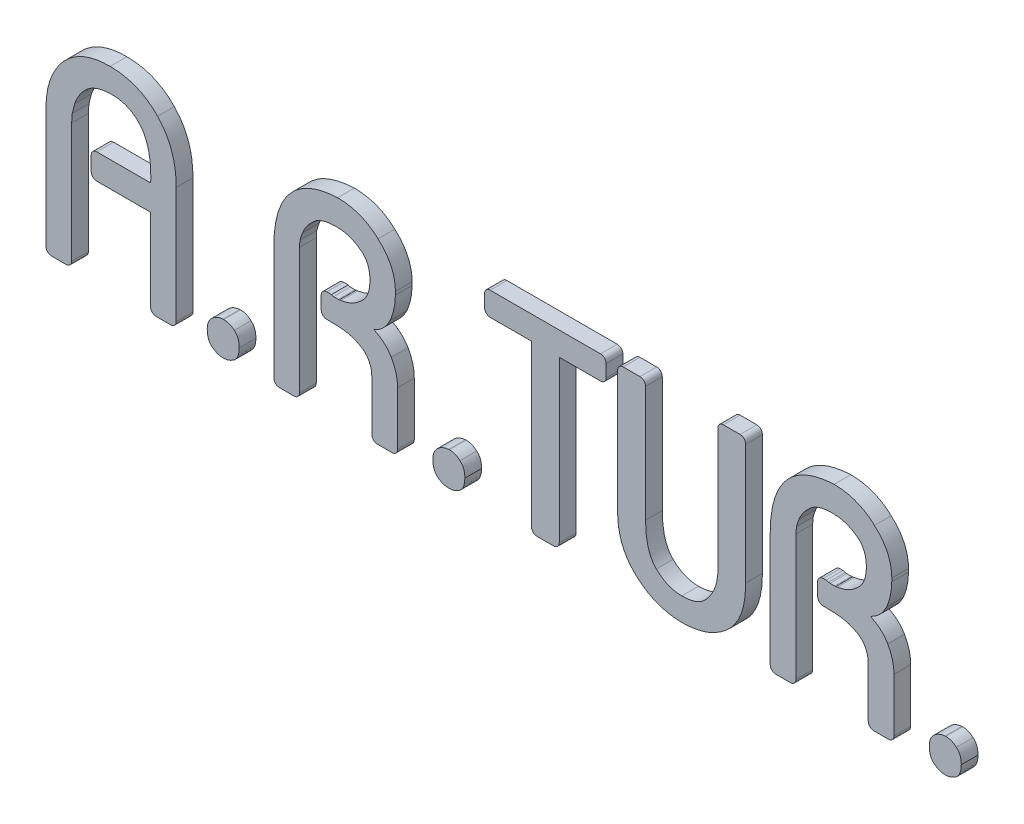
from build123d import *

# Parameters (mm, degrees)
BOSS_EXTRU_1_DEPTH      = 3
BOSS_EXTRU_1_2_DEPTH    = 3
BOSS_EXTRU_1_3_DEPTH    = 3
BOSS_EXTRU_1_4_DEPTH    = 3
BOSS_EXTRU_1_5_DEPTH    = 3
BOSS_EXTRU_1_6_DEPTH    = 3
BOSS_EXTRU_1_7_DEPTH    = 3
BOSS_EXTRU_1_8_DEPTH    = 3
ESQUISSE3_W             = 3
ESQUISSE3_H             = 4.561334753
ENL_V_MAT_EXTRU_1_DEPTH = 2
ESQUISSE4_W             = 3
ESQUISSE4_H             = 4.223978716
ENL_V_MAT_EXTRU_2_DEPTH = 2
ESQUISSE5_W             = 3
ESQUISSE5_H             = 4.223978716
ENL_V_MAT_EXTRU_3_DEPTH = 2
ENL_V_START             = -0.042618
ESQUISSE6_W             = 2
ESQUISSE6_H             = 3
ENL_V_MAT_EXTRU_4_DEPTH = 0.042618
ESQUISSE7_W             = 2
ESQUISSE7_H             = 3
ENL_V_MAT_EXTRU_5_DEPTH = 0.042618
CONG_1_R                = 1
CONG_2_R                = 1
CONG_3_R                = 1
CONG_4_R                = 1
CONG_6_R                = 1
CONG_7_R                = 1


with BuildPart() as part:
    # Esquisse2 → Boss.-Extru.1 (new body)
    with BuildSketch(Plane.XY):
        with BuildLine():
            Line((-83.102372291, -17.6), (-83.102372291, 4.988797988))
            add(Edge.make_bspline(
                [(-83.102372291, 4.988797988), (-83.092949675, 5.40390946), (-83.074474621, 6.217824362), (-82.928161922, 7.413883793), (-82.702489337, 8.561134049), (-82.365965622, 9.657730126), (-81.945713245, 10.711620833), (-81.420249619, 11.717859176), (-80.810673329, 12.687759692), (-80.334299867, 13.288630517), (-80.09428096, 13.591376935)],
                knots=[0, 0, 0, 0, 1.070056633, 2.098075088, 3.102701335, 4.081123745, 5.051437982, 6.024081097, 7.004440979, 8, 8, 8, 8], degree=3))
            add(Edge.make_bspline(
                [(-80.09428096, 13.591376935), (-79.828777775, 13.872098531), (-79.304302249, 14.426636538), (-78.410095479, 15.140317174), (-77.455694847, 15.754476186), (-76.424329439, 16.257125986), (-75.322014921, 16.653193397), (-74.143135808, 16.930597271), (-72.890777242, 17.103746811), (-72.031118657, 17.123487816), (-71.590097523, 17.133615325)],
                knots=[0, 0, 0, 0, 0.974449976, 1.924930451, 2.879798784, 3.834685434, 4.814987156, 5.830638503, 6.88707647, 8, 8, 8, 8], degree=3))
            add(Edge.make_bspline(
                [(-71.590097523, 17.133615325), (-71.170248689, 17.122468537), (-70.343784638, 17.100526307), (-69.133116, 16.937910349), (-67.976654601, 16.663009541), (-66.877454915, 16.27457455), (-65.832745601, 15.782259134), (-64.849097512, 15.180797247), (-63.925708524, 14.467639525), (-63.372967205, 13.914017488), (-63.092942337, 13.63354644)],
                knots=[0, 0, 0, 0, 1.064931283, 2.096295975, 3.09241473, 4.075522731, 5.048572496, 6.016927927, 6.995353749, 8, 8, 8, 8], degree=3))
            add(Edge.make_bspline(
                [(-63.092942337, 13.63354644), (-62.821079076, 13.337189325), (-62.278306348, 12.745514825), (-61.592405699, 11.75340296), (-61.008804489, 10.692623874), (-60.547818029, 9.550639645), (-60.180888697, 8.339606862), (-59.921752265, 7.047812098), (-59.765838178, 5.679098523), (-59.749047734, 4.738544543), (-59.740466718, 4.257859907)],
                knots=[0, 0, 0, 0, 0.943498659, 1.88368718, 2.824197585, 3.781502294, 4.770088047, 5.791872426, 6.871502305, 8, 8, 8, 8], degree=3))
            add(Edge.make_bspline(
                [(-59.740466718, 4.257859907), (-59.740466718, 4.243803406), (-59.740466718, 4.220375903), (-59.740466718, 4.1922629), (-59.740466718, 4.175863648), (-59.740466718, 4.168835397), (-59.740466718, 4.166492647)],
                knots=[0, 0, 0, 0, 1.846153846, 3.076923077, 3.692307692, 4, 4, 4, 4], degree=3))
            add(Edge.make_bspline(
                [(-59.740466718, 4.166492647), (-59.740466718, 4.152436146), (-59.740466718, 4.126665893), (-59.740466718, 4.091524639), (-59.740466718, 4.056383385), (-59.740466718, 4.032955882), (-59.740466718, 4.018899381)],
                knots=[0, 0, 0, 0, 1.142857143, 2.095238095, 2.857142857, 4, 4, 4, 4], degree=3))
            add(Edge.make_bspline(
                [(-59.740466718, 4.018899381), (-59.740466718, 4.002500129), (-59.740466718, 3.969701625), (-59.740466718, 3.92050387), (-59.740466718, 3.871306115), (-59.740466718, 3.838507611), (-59.740466718, 3.822108359)],
                knots=[0, 0, 0, 0, 1, 2, 3, 4, 4, 4, 4], degree=3))
            add(Edge.make_bspline(
                [(-59.740466718, 3.822108359), (-59.740466718, 3.803366357), (-59.740466718, 3.763539603), (-59.740466718, 3.697942595), (-59.740466718, 3.620631837), (-59.740466718, 3.564405831), (-59.740466718, 3.533950077)],
                knots=[0, 0, 0, 0, 0.780487805, 1.658536585, 2.731707317, 4, 4, 4, 4], degree=3))
            add(Edge.make_bspline(
                [(-59.740466718, 3.533950077), (-59.740466718, 3.517550826), (-59.740466718, 3.484752322), (-59.740466718, 3.435554567), (-59.740466718, 3.386356811), (-59.740466718, 3.353558308), (-59.740466718, 3.337159056)],
                knots=[0, 0, 0, 0, 1, 2, 3, 4, 4, 4, 4], degree=3))
            Line((-59.740466718, 3.337159056), (-59.740466718, -17.6))
            Line((-59.740466718, -17.6), (-64.350999226, -17.6))
            Line((-64.350999226, -17.6), (-64.350999226, -1.905916022))
            Line((-64.350999226, -1.905916022), (-76.987794118, -1.905916022))
            Line((-76.987794118, -1.905916022), (-76.987794118, 2.655418731))
            Line((-76.987794118, 2.655418731), (-64.350999226, 2.655418731))
            add(Edge.make_bspline(
                [(-64.350999226, 2.655418731), (-64.350999226, 2.662446981), (-64.350999226, 2.685874484), (-64.350999226, 2.732729489), (-64.350999226, 2.791298246), (-64.350999226, 2.83346775), (-64.350999226, 2.852209752)],
                knots=[0, 0, 0, 0, 0.428571429, 1.428571429, 2.857142857, 4, 4, 4, 4], degree=3))
            add(Edge.make_bspline(
                [(-64.350999226, 2.852209752), (-64.350765827, 2.868603748), (-64.350299028, 2.901391741), (-64.353846716, 2.951325611), (-64.338984044, 3.004598761), (-64.314864967, 3.033400844), (-64.301801471, 3.049000774)],
                knots=[0, 0, 0, 0, 0.937005296, 1.874010592, 2.84851081, 4, 4, 4, 4], degree=3))
            add(Edge.make_bspline(
                [(-64.301801471, 3.049000774), (-64.301801471, 3.053686275), (-64.301801471, 3.067742776), (-64.301801471, 3.098198529), (-64.301801471, 3.140368034), (-64.301801471, 3.173166538), (-64.301801471, 3.189565789)],
                knots=[0, 0, 0, 0, 0.4, 1.2, 2.6, 4, 4, 4, 4], degree=3))
            add(Edge.make_bspline(
                [(-64.301801471, 3.189565789), (-64.301801471, 3.220021543), (-64.301801471, 3.276247549), (-64.301801471, 3.355901058), (-64.301801471, 3.423840815), (-64.301801471, 3.46601032), (-64.301801471, 3.484752322)],
                knots=[0, 0, 0, 0, 1.238095238, 2.285714286, 3.238095238, 4, 4, 4, 4], degree=3))
            add(Edge.make_bspline(
                [(-64.301801471, 3.484752322), (-64.301801471, 3.501151574), (-64.301801471, 3.533950077), (-64.301801471, 3.583147833), (-64.301801471, 3.630002838), (-64.301801471, 3.660458591), (-64.301801471, 3.674515093)],
                knots=[0, 0, 0, 0, 1.037037037, 2.074074074, 3.111111111, 4, 4, 4, 4], degree=3))
            add(Edge.make_bspline(
                [(-64.301801471, 3.674515093), (-64.301801471, 3.679200593), (-64.301801471, 3.695599845), (-64.301801471, 3.728398349), (-64.301801471, 3.772910604), (-64.301801471, 3.805709107), (-64.301801471, 3.822108359)],
                knots=[0, 0, 0, 0, 0.380952381, 1.333333333, 2.666666667, 4, 4, 4, 4], degree=3))
            add(Edge.make_bspline(
                [(-64.301801471, 3.822108359), (-64.307024014, 4.190068887), (-64.317151128, 4.903586858), (-64.399981736, 5.93939485), (-64.546514039, 6.902264108), (-64.749447713, 7.793161411), (-65.007131916, 8.610438836), (-65.32364891, 9.356197382), (-65.701931434, 10.028166041), (-66.00298045, 10.429266398), (-66.150231424, 10.625455108)],
                knots=[0, 0, 0, 0, 1.228968542, 2.38311198, 3.467697717, 4.479462079, 5.432252885, 6.326186899, 7.181294084, 8, 8, 8, 8], degree=3))
            add(Edge.make_bspline(
                [(-66.150231424, 10.625455108), (-66.307762348, 10.805216678), (-66.618705429, 11.160039814), (-67.15504516, 11.619216054), (-67.732525384, 12.017171391), (-68.360132612, 12.338083878), (-69.026513377, 12.594608438), (-69.734047066, 12.775290246), (-70.480426803, 12.892297343), (-70.992246275, 12.903788222), (-71.252741486, 12.90963661)],
                knots=[0, 0, 0, 0, 0.990712156, 1.955521383, 2.920820236, 3.894744745, 4.873267486, 5.877715849, 6.919844033, 8, 8, 8, 8], degree=3))
            add(Edge.make_bspline(
                [(-71.252741486, 12.90963661), (-71.496674892, 12.907264293), (-71.971815911, 12.902643419), (-72.661524962, 12.818429936), (-73.312758383, 12.706317479), (-73.917756246, 12.526362361), (-74.478007995, 12.311577584), (-74.993200034, 12.056291082), (-75.459916821, 11.756370946), (-75.734731296, 11.516764757), (-75.870302245, 11.398562693)],
                knots=[0, 0, 0, 0, 1.176399509, 2.291427287, 3.349265731, 4.361905875, 5.331989761, 6.242172059, 7.132831703, 8, 8, 8, 8], degree=3))
            add(Edge.make_bspline(
                [(-75.870302245, 11.398562693), (-76.114400054, 11.154407205), (-76.591461634, 10.677232897), (-77.166692333, 9.866053774), (-77.622837634, 9.022278473), (-77.846727418, 8.435369278), (-77.957692724, 8.144482585)],
                knots=[0, 0, 0, 0, 1.05958582, 2.070840728, 3.043861015, 4, 4, 4, 4], degree=3))
            add(Edge.make_bspline(
                [(-77.957692724, 8.144482585), (-78.000716745, 7.999476712), (-78.08641238, 7.7106527), (-78.199268787, 7.274715811), (-78.294336409, 6.837063024), (-78.360408318, 6.546671937), (-78.393444272, 6.401476393)],
                knots=[0, 0, 0, 0, 1.00988184, 2.011491803, 3.005745901, 4, 4, 4, 4], degree=3))
            add(Edge.make_bspline(
                [(-78.393444272, 6.401476393), (-78.407352957, 6.260910401), (-78.434000309, 5.991603005), (-78.474522715, 5.605660816), (-78.485531775, 5.241867631), (-78.489737534, 5.007534118), (-78.491839783, 4.890402477)],
                knots=[0, 0, 0, 0, 1.118848889, 2.14357881, 3.07206759, 4, 4, 4, 4], degree=3))
            Line((-78.491839783, 4.890402477), (-78.491839783, -17.6))
            Line((-78.491839783, -17.6), (-83.102372291, -17.6))
        make_face()
    extrude(amount=BOSS_EXTRU_1_DEPTH)

    # Esquisse3 → Enlèv. mat.-Extru.1 (cut)
    with BuildSketch(Plane.ZY.offset(76.987794118)):
        with Locations((1.5, 0.374751354)):
            Rectangle(ESQUISSE3_W, ESQUISSE3_H)
    extrude(amount=-ENL_V_MAT_EXTRU_1_DEPTH, mode=Mode.SUBTRACT)

    # Congé1
    cong_1_edges = [part.edges().sort_by_distance(p)[0] for p in [
        (-64.350999226, -17.6, 1.5),
        (-59.740466718, -17.6, 1.5),
        (-83.102372291, -17.6, 1.5),
        (-74.987794118, 2.655418731, 1.5),
        (-74.987794118, -1.905916022, 1.5),
    ]]
    fillet(cong_1_edges, radius=CONG_1_R)

    # Congé7
    cong_7_edges = [part.edges().sort_by_distance(p)[0] for p in [
        (-78.491839783, -17.6, 1.5),
    ]]
    fillet(cong_7_edges, radius=CONG_7_R)


with BuildPart() as body_2:
    # Esquisse2 → Boss.-Extru.1 2 (new body)
    with BuildSketch(Plane.XY):
        with BuildLine():
            add(Edge.make_bspline(
                [(-54.174092105, -14.929264706), (-54.163600311, -14.72419675), (-54.143227617, -14.326001122), (-53.975244075, -13.758536598), (-53.704755387, -13.246856526), (-53.436487202, -12.976709959), (-53.302589009, -12.841874226)],
                knots=[0, 0, 0, 0, 1.054600379, 2.047795612, 3.025614461, 4, 4, 4, 4], degree=3))
            add(Edge.make_bspline(
                [(-53.302589009, -12.841874226), (-53.154531954, -12.720683836), (-52.869816804, -12.487633541), (-52.380188948, -12.248250259), (-51.878738801, -12.079908599), (-51.530348082, -12.035030045), (-51.355763545, -12.012540635)],
                knots=[0, 0, 0, 0, 1.063594773, 2.045303048, 3.020467982, 4, 4, 4, 4], degree=3))
            add(Edge.make_bspline(
                [(-51.355763545, -12.012540635), (-51.351078044, -12.012540635), (-51.334678793, -12.012540635), (-51.318279541, -12.012540635), (-51.306565789, -12.012540635)],
                knots=[0, 0, 0, 0, 0.571428571, 2, 2, 2, 2], degree=3))
            add(Edge.make_bspline(
                [(-51.306565789, -12.012540635), (-51.304223039, -12.012540635), (-51.297194788, -12.012540635), (-51.278452786, -12.012540635), (-51.247997033, -12.012540635), (-51.22222678, -12.012540635), (-51.208170279, -12.012540635)],
                knots=[0, 0, 0, 0, 0.285714286, 0.857142857, 2.285714286, 4, 4, 4, 4], degree=3))
            add(Edge.make_bspline(
                [(-51.208170279, -12.012540635), (-51.036111397, -12.01951332), (-50.69819895, -12.03320722), (-50.208159882, -12.177048502), (-49.736815974, -12.403487604), (-49.461061808, -12.627113243), (-49.31757082, -12.743478715)],
                knots=[0, 0, 0, 0, 0.993501924, 1.951173132, 2.933875801, 4, 4, 4, 4], degree=3))
            add(Edge.make_bspline(
                [(-49.31757082, -12.743478715), (-49.182505005, -12.870348994), (-48.903547787, -13.132379618), (-48.636768572, -13.679227357), (-48.465569863, -14.318912739), (-48.44821006, -14.782672119), (-48.439039474, -15.027660217)],
                knots=[0, 0, 0, 0, 0.873343845, 1.803754468, 2.839799172, 4, 4, 4, 4], degree=3))
            add(Edge.make_bspline(
                [(-48.439039474, -15.027660217), (-48.448301747, -15.270264703), (-48.465914936, -15.731602711), (-48.638742072, -16.373285449), (-48.908490778, -16.930709362), (-49.182958965, -17.214719537), (-49.31757082, -17.354011223)],
                knots=[0, 0, 0, 0, 1.134974735, 2.158274115, 3.096732702, 4, 4, 4, 4], degree=3))
            add(Edge.make_bspline(
                [(-49.31757082, -17.354011223), (-49.466168604, -17.445308795), (-49.763001621, -17.627681192), (-50.231065983, -17.859822021), (-50.735822033, -18.006250317), (-51.083076031, -18.025892727), (-51.257368034, -18.035751548)],
                knots=[0, 0, 0, 0, 1.003202675, 2.003957737, 2.998156372, 4, 4, 4, 4], degree=3))
            add(Edge.make_bspline(
                [(-51.257368034, -18.035751548), (-51.433861009, -18.027563869), (-51.789000621, -18.0110886), (-52.308423864, -17.87917779), (-52.810743245, -17.672513208), (-53.104711184, -17.460992156), (-53.253391254, -17.354011223)],
                knots=[0, 0, 0, 0, 0.985163287, 1.982348061, 2.979532834, 4, 4, 4, 4], degree=3))
            add(Edge.make_bspline(
                [(-53.253391254, -17.354011223), (-53.400500434, -17.215941043), (-53.696038366, -16.938562191), (-53.985509035, -16.377418442), (-54.14393965, -15.730090063), (-54.163691694, -15.269947585), (-54.174092105, -15.027660217)],
                knots=[0, 0, 0, 0, 0.929924183, 1.868189794, 2.877498366, 4, 4, 4, 4], degree=3))
            Line((-54.174092105, -15.027660217), (-54.174092105, -14.929264706))
        make_face()
    extrude(amount=BOSS_EXTRU_1_2_DEPTH)


with BuildPart() as body_3:
    # Esquisse2 → Boss.-Extru.1 3 (new body)
    with BuildSketch(Plane.XY):
        with BuildLine():
            Line((-42.23309404, -17.6), (-42.23309404, 3.822108359))
            add(Edge.make_bspline(
                [(-42.23309404, 3.822108359), (-42.226151894, 4.326138767), (-42.212628984, 5.307961579), (-42.074694422, 6.735286866), (-41.86277896, 8.075689269), (-41.552880443, 9.326772182), (-41.154773261, 10.490788074), (-40.659925778, 11.567690798), (-40.073870543, 12.560196271), (-39.599976662, 13.15136526), (-39.365567724, 13.443783669)],
                knots=[0, 0, 0, 0, 1.179465841, 2.29753295, 3.353222995, 4.353387927, 5.310675874, 6.228348747, 7.123662693, 8, 8, 8, 8], degree=3))
            add(Edge.make_bspline(
                [(-39.365567724, 13.443783669), (-39.121693683, 13.717775155), (-38.634170173, 14.265505819), (-37.775767399, 14.966634997), (-36.838643825, 15.587417004), (-35.794376991, 16.08844433), (-34.665702894, 16.506161911), (-33.445275857, 16.817750041), (-32.13811315, 17.039653261), (-31.234739754, 17.101697753), (-30.770017028, 17.133615325)],
                knots=[0, 0, 0, 0, 0.912478216, 1.82411617, 2.751644032, 3.706940466, 4.702190389, 5.745444488, 6.840188135, 8, 8, 8, 8], degree=3))
            add(Edge.make_bspline(
                [(-30.770017028, 17.133615325), (-30.427647605, 17.125390524), (-29.749907208, 17.109109047), (-28.751056437, 16.983358939), (-27.78922204, 16.759033008), (-26.856216318, 16.469069766), (-25.962129269, 16.076572128), (-25.099185222, 15.609347435), (-24.284856227, 15.033487106), (-23.784586325, 14.589575164), (-23.530918731, 14.36448452)],
                knots=[0, 0, 0, 0, 1.034309447, 2.047476348, 3.034821847, 4.015318387, 4.994945852, 5.980157755, 6.975815814, 8, 8, 8, 8], degree=3))
            add(Edge.make_bspline(
                [(-23.530918731, 14.36448452), (-23.281632495, 14.138077508), (-22.793375739, 13.694632433), (-22.167524524, 12.945063198), (-21.626131532, 12.16497095), (-21.193998208, 11.33811088), (-20.841451699, 10.486613518), (-20.607535868, 9.599623963), (-20.451323817, 8.688836491), (-20.433451987, 8.070174105), (-20.424431889, 7.757928793)],
                knots=[0, 0, 0, 0, 1.071402239, 2.098468779, 3.102259339, 4.090284332, 5.064376597, 6.03098092, 7.006215681, 8, 8, 8, 8], degree=3))
            add(Edge.make_bspline(
                [(-20.424431889, 7.757928793), (-20.424431889, 7.739186791), (-20.424431889, 7.697017286), (-20.424431889, 7.629077528), (-20.424431889, 7.55176677), (-20.424431889, 7.497883514), (-20.424431889, 7.469770511)],
                knots=[0, 0, 0, 0, 0.780487805, 1.756097561, 2.829268293, 4, 4, 4, 4], degree=3))
            add(Edge.make_bspline(
                [(-20.424431889, 7.469770511), (-20.424431889, 7.451028509), (-20.424431889, 7.408859004), (-20.424431889, 7.340919247), (-20.424431889, 7.261265738), (-20.424431889, 7.205039732), (-20.424431889, 7.174583978)],
                knots=[0, 0, 0, 0, 0.761904762, 1.714285714, 2.761904762, 4, 4, 4, 4], degree=3))
            add(Edge.make_bspline(
                [(-20.424431889, 7.174583978), (-20.436700973, 6.791920273), (-20.46107857, 6.031600981), (-20.652372058, 4.916243241), (-20.938523061, 3.835284456), (-21.20946538, 3.147434884), (-21.34513274, 2.803011997)],
                knots=[0, 0, 0, 0, 1.020809319, 2.028258779, 3.012701566, 4, 4, 4, 4], degree=3))
            add(Edge.make_bspline(
                [(-21.34513274, 2.803011997), (-21.516652382, 2.479454012), (-21.851420387, 1.847941144), (-22.535819013, 1.037430808), (-23.333559031, 0.361175813), (-23.949972713, 0.045838001), (-24.261856811, -0.113712074)],
                knots=[0, 0, 0, 0, 1.041192477, 2.032174995, 3.004348305, 4, 4, 4, 4], degree=3))
            add(Edge.make_bspline(
                [(-24.261856811, -0.113712074), (-23.946926179, -0.268175286), (-23.325929116, -0.572754108), (-22.49438437, -1.196029604), (-21.737486906, -1.932003488), (-21.348398588, -2.52747339), (-21.148341718, -2.833645124)],
                knots=[0, 0, 0, 0, 1.000493697, 1.972826981, 2.957691943, 4, 4, 4, 4], degree=3))
            add(Edge.make_bspline(
                [(-21.148341718, -2.833645124), (-20.982184853, -3.148275586), (-20.645856954, -3.785137636), (-20.30805151, -4.822482287), (-20.066699192, -5.901033655), (-20.042800352, -6.639272898), (-20.030849845, -7.008426084)],
                knots=[0, 0, 0, 0, 0.975776978, 1.975127657, 2.987471768, 4, 4, 4, 4], degree=3))
            Line((-20.030849845, -7.008426084), (-20.030849845, -17.6))
            Line((-20.030849845, -17.6), (-24.648410604, -17.6))
            Line((-24.648410604, -17.6), (-24.648410604, -7.640968653))
            add(Edge.make_bspline(
                [(-24.648410604, -7.640968653), (-24.653718845, -7.443905698), (-24.664070912, -7.059595982), (-24.747042758, -6.50182528), (-24.896368343, -5.982894056), (-25.103126625, -5.503681138), (-25.351457034, -5.055929221), (-25.670276959, -4.661596751), (-26.024951633, -4.294582338), (-26.305797945, -4.099077072), (-26.447642802, -4.000334752)],
                knots=[0, 0, 0, 0, 1.114967711, 2.174396123, 3.181511139, 4.161646928, 5.123680777, 6.067917283, 7.024178051, 8, 8, 8, 8], degree=3))
            add(Edge.make_bspline(
                [(-26.447642802, -4.000334752), (-26.770455743, -3.815727788), (-27.431723584, -3.437568696), (-28.555102069, -3.071622467), (-29.788907994, -2.820197892), (-30.656134062, -2.796682831), (-31.107373065, -2.784447368)],
                knots=[0, 0, 0, 0, 0.912720846, 1.869667741, 2.891535853, 4, 4, 4, 4], degree=3))
            Line((-31.107373065, -2.784447368), (-35.724933824, -2.686051858))
            Line((-35.724933824, -2.686051858), (-35.724933824, 1.537926858))
            Line((-35.724933824, 1.537926858), (-31.887508901, 1.537926858))
            add(Edge.make_bspline(
                [(-31.887508901, 1.537926858), (-31.856076073, 1.510251084), (-31.797752811, 1.458898993), (-31.694318732, 1.413670372), (-31.594823442, 1.404266567), (-31.531385875, 1.399600255), (-31.500955108, 1.397361842)],
                knots=[0, 0, 0, 0, 1.182697103, 2.194481306, 3.133899354, 4, 4, 4, 4], degree=3))
            add(Edge.make_bspline(
                [(-31.500955108, 1.397361842), (-31.468156605, 1.397361842), (-31.402559598, 1.397361842), (-31.304164087, 1.397361842), (-31.205768576, 1.397361842), (-31.140171569, 1.397361842), (-31.107373065, 1.397361842)],
                knots=[0, 0, 0, 0, 1, 2, 3, 4, 4, 4, 4], degree=3))
            add(Edge.make_bspline(
                [(-31.107373065, 1.397361842), (-31.072231811, 1.397361842), (-30.999606553, 1.397361842), (-30.889497291, 1.397361842), (-30.779388029, 1.397361842), (-30.706762771, 1.397361842), (-30.671621517, 1.397361842)],
                knots=[0, 0, 0, 0, 0.967741935, 2, 3.032258065, 4, 4, 4, 4], degree=3))
            add(Edge.make_bspline(
                [(-30.671621517, 1.397361842), (-30.655231836, 1.397536199), (-30.622452475, 1.397884912), (-30.567896139, 1.39499314), (-30.50247276, 1.411069781), (-30.45792751, 1.433714999), (-30.432660991, 1.446559598)],
                knots=[0, 0, 0, 0, 0.79314293, 1.586285859, 2.630916788, 4, 4, 4, 4], degree=3))
            add(Edge.make_bspline(
                [(-30.432660991, 1.446559598), (-30.413918989, 1.446559598), (-30.374092234, 1.446559598), (-30.310837977, 1.446559598), (-30.24758372, 1.446559598), (-30.205414216, 1.446559598), (-30.186672214, 1.446559598)],
                knots=[0, 0, 0, 0, 0.914285714, 1.942857143, 3.085714286, 4, 4, 4, 4], degree=3))
            add(Edge.make_bspline(
                [(-30.186672214, 1.446559598), (-29.865477854, 1.507284595), (-29.223876692, 1.628585695), (-28.300573543, 1.984942769), (-27.415774265, 2.471677056), (-26.899758412, 2.914982585), (-26.637405573, 3.140368034)],
                knots=[0, 0, 0, 0, 0.981007491, 1.959609586, 2.962624468, 4, 4, 4, 4], degree=3))
            add(Edge.make_bspline(
                [(-26.637405573, 3.140368034), (-26.505798033, 3.25937099), (-26.244620274, 3.495534704), (-25.901142154, 3.90041795), (-25.623147617, 4.354074456), (-25.388399688, 4.843455303), (-25.203929323, 5.373341172), (-25.08258895, 5.942627118), (-25.001757042, 6.54678156), (-24.991203802, 6.961114463), (-24.985766641, 7.174583978)],
                knots=[0, 0, 0, 0, 0.944183768, 1.873751319, 2.815211831, 3.76931437, 4.759511945, 5.794580443, 6.863740143, 8, 8, 8, 8], degree=3))
            add(Edge.make_bspline(
                [(-24.985766641, 7.174583978), (-24.988947539, 7.378642469), (-24.995146941, 7.776341764), (-25.067806573, 8.349847072), (-25.177753323, 8.885318071), (-25.340623475, 9.376906597), (-25.542789274, 9.832468189), (-25.79718059, 10.240122088), (-26.094179703, 10.607929201), (-26.329549564, 10.81148325), (-26.447642802, 10.91361339)],
                knots=[0, 0, 0, 0, 1.178060027, 2.295977203, 3.333782085, 4.330908085, 5.281779262, 6.205590154, 7.099682225, 8, 8, 8, 8], degree=3))
            add(Edge.make_bspline(
                [(-26.447642802, 10.91361339), (-26.689540454, 11.095468677), (-27.164689389, 11.452679031), (-27.939101204, 11.876618343), (-28.751289668, 12.196624938), (-29.317607821, 12.31550967), (-29.603327399, 12.375489551)],
                knots=[0, 0, 0, 0, 1.032112255, 2.027332774, 3.004747339, 4, 4, 4, 4], degree=3))
            add(Edge.make_bspline(
                [(-29.603327399, 12.375489551), (-29.6687173, 12.390716634), (-29.798694741, 12.420983957), (-29.994333004, 12.44519963), (-30.188389152, 12.470686212), (-30.317772916, 12.472807863), (-30.383463235, 12.473885062)],
                knots=[0, 0, 0, 0, 1.021753461, 2.030969595, 3.000290038, 4, 4, 4, 4], degree=3))
            add(Edge.make_bspline(
                [(-30.383463235, 12.473885062), (-30.413933589, 12.474106033), (-30.47721817, 12.474564972), (-30.568743129, 12.471082715), (-30.653846297, 12.482138029), (-30.700118073, 12.505571039), (-30.720819272, 12.516054567)],
                knots=[0, 0, 0, 0, 1.060913082, 2.203434863, 3.196247532, 4, 4, 4, 4], degree=3))
            add(Edge.make_bspline(
                [(-30.720819272, 12.516054567), (-30.753617776, 12.516054567), (-30.819214783, 12.516054567), (-30.915267544, 12.516054567), (-31.011320304, 12.516054567), (-31.074574561, 12.516054567), (-31.107373065, 12.516054567)],
                knots=[0, 0, 0, 0, 1.018181818, 2.036363636, 2.981818182, 4, 4, 4, 4], degree=3))
            add(Edge.make_bspline(
                [(-31.107373065, 12.516054567), (-31.320674767, 12.511599071), (-31.733986156, 12.502965726), (-32.333428789, 12.448248591), (-32.893200014, 12.350321099), (-33.412566851, 12.209954744), (-33.892821419, 12.034512224), (-34.336411601, 11.823476142), (-34.737077564, 11.564342803), (-34.975070731, 11.35914934), (-35.092391254, 11.257997678)],
                knots=[0, 0, 0, 0, 1.196716369, 2.318858688, 3.373380872, 4.380903618, 5.333156405, 6.238443452, 7.131627443, 8, 8, 8, 8], degree=3))
            add(Edge.make_bspline(
                [(-35.092391254, 11.257997678), (-35.32045101, 11.047755769), (-35.760485464, 10.642100314), (-36.31118441, 9.966134448), (-36.759413171, 9.271482081), (-36.975079005, 8.780220203), (-37.081386223, 8.538064628)],
                knots=[0, 0, 0, 0, 1.093258391, 2.109409256, 3.068079353, 4, 4, 4, 4], degree=3))
            add(Edge.make_bspline(
                [(-37.081386223, 8.538064628), (-37.127105111, 8.423719405), (-37.216839312, 8.199289681), (-37.329365347, 7.858359519), (-37.426256817, 7.516764316), (-37.491323224, 7.28936542), (-37.524166022, 7.174583978)],
                knots=[0, 0, 0, 0, 1.029919799, 2.021462798, 3.001317259, 4, 4, 4, 4], degree=3))
            add(Edge.make_bspline(
                [(-37.524166022, 7.174583978), (-37.539102904, 7.066924246), (-37.568265652, 6.85672953), (-37.595593904, 6.554158255), (-37.609527115, 6.272746861), (-37.613567304, 6.094587587), (-37.615533282, 6.00789435)],
                knots=[0, 0, 0, 0, 1.113557543, 2.174108249, 3.111511493, 4, 4, 4, 4], degree=3))
            Line((-37.615533282, 6.00789435), (-37.615533282, -17.6))
            Line((-37.615533282, -17.6), (-42.23309404, -17.6))
        make_face()
    extrude(amount=BOSS_EXTRU_1_3_DEPTH)

    # Esquisse4 → Enlèv. mat.-Extru.2 (cut)
    with BuildSketch(Plane.ZY.offset(35.724933824)):
        with Locations((1.5, -0.5740625)):
            Rectangle(ESQUISSE4_W, ESQUISSE4_H)
    extrude(amount=-ENL_V_MAT_EXTRU_2_DEPTH, mode=Mode.SUBTRACT)

    # Esquisse7 → Enlèv. mat.-Extru.5 (cut)
    with BuildSketch(Plane(origin=(0, -2.686051858, 0), x_dir=(1, 0, 0), z_dir=(0, 1, 0)).offset(ENL_V_START)):
        with Locations((-34.724933824, -1.5)):
            Rectangle(ESQUISSE7_W, ESQUISSE7_H)
    extrude(amount=ENL_V_MAT_EXTRU_5_DEPTH, mode=Mode.SUBTRACT)

    # Congé2
    cong_2_edges = [body_3.edges().sort_by_distance(p)[0] for p in [
        (-33.724933824, -2.728669858, 1.5),
        (-37.615533282, -17.6, 1.5),
        (-24.648410604, -17.6, 1.5),
        (-20.030849845, -17.6, 1.5),
        (-42.23309404, -17.6, 1.5),
        (-33.724933824, 1.537926858, 1.5),
    ]]
    fillet(cong_2_edges, radius=CONG_2_R)


with BuildPart() as body_4:
    # Esquisse2 → Boss.-Extru.1 4 (new body)
    with BuildSketch(Plane.XY):
        with BuildLine():
            add(Edge.make_bspline(
                [(-13.691367647, -14.929264706), (-13.680875853, -14.72419675), (-13.660503159, -14.326001122), (-13.492519616, -13.758536598), (-13.222030928, -13.246856526), (-12.953762744, -12.976709959), (-12.819864551, -12.841874226)],
                knots=[0, 0, 0, 0, 1.054600379, 2.047795612, 3.025614461, 4, 4, 4, 4], degree=3))
            add(Edge.make_bspline(
                [(-12.819864551, -12.841874226), (-12.671807496, -12.720683836), (-12.387092345, -12.487633541), (-11.89746449, -12.248250259), (-11.396014342, -12.079908599), (-11.047623624, -12.035030045), (-10.873039087, -12.012540635)],
                knots=[0, 0, 0, 0, 1.063594773, 2.045303048, 3.020467982, 4, 4, 4, 4], degree=3))
            add(Edge.make_bspline(
                [(-10.873039087, -12.012540635), (-10.868353586, -12.012540635), (-10.851954334, -12.012540635), (-10.835555083, -12.012540635), (-10.823841331, -12.012540635)],
                knots=[0, 0, 0, 0, 0.571428571, 2, 2, 2, 2], degree=3))
            add(Edge.make_bspline(
                [(-10.823841331, -12.012540635), (-10.821498581, -12.012540635), (-10.81447033, -12.012540635), (-10.795728328, -12.012540635), (-10.765272575, -12.012540635), (-10.739502322, -12.012540635), (-10.72544582, -12.012540635)],
                knots=[0, 0, 0, 0, 0.285714286, 0.857142857, 2.285714286, 4, 4, 4, 4], degree=3))
            add(Edge.make_bspline(
                [(-10.72544582, -12.012540635), (-10.553386939, -12.01951332), (-10.215474492, -12.03320722), (-9.725435424, -12.177048502), (-9.254091516, -12.403487604), (-8.97833735, -12.627113243), (-8.834846362, -12.743478715)],
                knots=[0, 0, 0, 0, 0.993501924, 1.951173132, 2.933875801, 4, 4, 4, 4], degree=3))
            add(Edge.make_bspline(
                [(-8.834846362, -12.743478715), (-8.699780546, -12.870348994), (-8.420823329, -13.132379618), (-8.154044114, -13.679227357), (-7.982845405, -14.318912739), (-7.965485601, -14.782672119), (-7.956315015, -15.027660217)],
                knots=[0, 0, 0, 0, 0.873343845, 1.803754468, 2.839799172, 4, 4, 4, 4], degree=3))
            add(Edge.make_bspline(
                [(-7.956315015, -15.027660217), (-7.965577289, -15.270264703), (-7.983190478, -15.731602711), (-8.156017613, -16.373285449), (-8.42576632, -16.930709362), (-8.700234507, -17.214719537), (-8.834846362, -17.354011223)],
                knots=[0, 0, 0, 0, 1.134974735, 2.158274115, 3.096732702, 4, 4, 4, 4], degree=3))
            add(Edge.make_bspline(
                [(-8.834846362, -17.354011223), (-8.983444145, -17.445308795), (-9.280277163, -17.627681192), (-9.748341525, -17.859822021), (-10.253097575, -18.006250317), (-10.600351572, -18.025892727), (-10.774643576, -18.035751548)],
                knots=[0, 0, 0, 0, 1.003202675, 2.003957737, 2.998156372, 4, 4, 4, 4], degree=3))
            add(Edge.make_bspline(
                [(-10.774643576, -18.035751548), (-10.951136551, -18.027563869), (-11.306276163, -18.0110886), (-11.825699406, -17.87917779), (-12.328018786, -17.672513208), (-12.621986726, -17.460992156), (-12.770666796, -17.354011223)],
                knots=[0, 0, 0, 0, 0.985163287, 1.982348061, 2.979532834, 4, 4, 4, 4], degree=3))
            add(Edge.make_bspline(
                [(-12.770666796, -17.354011223), (-12.917775976, -17.215941043), (-13.213313908, -16.938562191), (-13.502784577, -16.377418442), (-13.661215192, -15.730090063), (-13.680967236, -15.269947585), (-13.691367647, -15.027660217)],
                knots=[0, 0, 0, 0, 0.929924183, 1.868189794, 2.877498366, 4, 4, 4, 4], degree=3))
            Line((-13.691367647, -15.027660217), (-13.691367647, -14.929264706))
        make_face()
    extrude(amount=BOSS_EXTRU_1_4_DEPTH)


with BuildPart() as body_5:
    # Esquisse2 → Boss.-Extru.1 5 (new body)
    with BuildSketch(Plane.XY):
        Polygon((-4.421104876, 12.227896285), (-4.421104876, 16.451875), (17.387557276, 16.451875), (17.387557276, 12.227896285), (8.98176935, 12.227896285), (8.98176935, -17.6), (3.977654799, -17.6), (3.977654799, 12.227896285), align=None)
    extrude(amount=BOSS_EXTRU_1_5_DEPTH)

    # Congé6
    cong_6_edges = [body_5.edges().sort_by_distance(p)[0] for p in [
        (3.977654799, -17.6, 1.5),
        (8.98176935, -17.6, 1.5),
        (17.387557276, 12.227896285, 1.5),
        (17.387557276, 16.451875, 1.5),
        (-4.421104876, 16.451875, 1.5),
        (-4.421104876, 12.227896285, 1.5),
    ]]
    fillet(cong_6_edges, radius=CONG_6_R)


with BuildPart() as body_6:
    # Esquisse2 → Boss.-Extru.1 6 (new body)
    with BuildSketch(Plane.XY):
        with BuildLine():
            Line((19.453863003, 16.451875), (24.457977554, 16.451875))
            Line((24.457977554, 16.451875), (24.457977554, -5.356787152))
            add(Edge.make_bspline(
                [(24.457977554, -5.356787152), (24.462391164, -5.73883946), (24.470853409, -6.471350986), (24.561809286, -7.523752991), (24.715938587, -8.481853063), (24.921448992, -9.351983058), (25.197521685, -10.130804258), (25.526522716, -10.826572625), (25.919970932, -11.442879434), (26.240293704, -11.791801483), (26.397774768, -11.963342879)],
                knots=[0, 0, 0, 0, 1.298861916, 2.490316912, 3.587787158, 4.596338159, 5.526051681, 6.391865977, 7.209389158, 8, 8, 8, 8], degree=3))
            add(Edge.make_bspline(
                [(26.397774768, -11.963342879), (26.561689417, -12.11149355), (26.883504885, -12.402359424), (27.403829527, -12.785126801), (27.940565693, -13.115492658), (28.503421382, -13.386440648), (29.087942919, -13.596436292), (29.694410946, -13.752664442), (30.3236032, -13.846731038), (30.75028558, -13.856186973), (30.966137771, -13.860970588)],
                knots=[0, 0, 0, 0, 1.044444942, 2.050570462, 3.050146134, 4.021502903, 4.9994102, 5.983013425, 6.979636861, 8, 8, 8, 8], degree=3))
            add(Edge.make_bspline(
                [(30.966137771, -13.860970588), (31.217112202, -13.856473991), (31.704450765, -13.847742562), (32.413099843, -13.754218182), (33.072622406, -13.601739682), (33.685807145, -13.388773756), (34.252806548, -13.11842055), (34.764231921, -12.764940258), (35.232859534, -12.353763877), (35.494449182, -12.02840364), (35.625868034, -11.864947368)],
                knots=[0, 0, 0, 0, 1.142842055, 2.219154366, 3.249557427, 4.221708043, 5.171632766, 6.101191801, 7.046066255, 8, 8, 8, 8], degree=3))
            add(Edge.make_bspline(
                [(35.625868034, -11.864947368), (35.869213208, -11.539411686), (36.348950102, -10.897642322), (36.865903634, -9.816578095), (37.23216276, -8.681102145), (37.327673542, -7.891892916), (37.375902477, -7.493375387)],
                knots=[0, 0, 0, 0, 1.018437844, 2.007774393, 2.994009704, 4, 4, 4, 4], degree=3))
            add(Edge.make_bspline(
                [(37.375902477, -7.493375387), (37.376080252, -7.476988623), (37.376410407, -7.446556061), (37.373830757, -7.394320011), (37.390811309, -7.329401457), (37.412443737, -7.282093406), (37.425100232, -7.254414861)],
                knots=[0, 0, 0, 0, 0.795013122, 1.476452941, 2.523547059, 4, 4, 4, 4], degree=3))
            add(Edge.make_bspline(
                [(37.425100232, -7.254414861), (37.425100232, -7.238015609), (37.425100232, -7.205217105), (37.425100232, -7.15601935), (37.425100232, -7.106821594), (37.425100232, -7.074023091), (37.425100232, -7.057623839)],
                knots=[0, 0, 0, 0, 1, 2, 3, 4, 4, 4, 4], degree=3))
            add(Edge.make_bspline(
                [(37.425100232, -7.057623839), (37.425100232, -7.022482585), (37.425100232, -6.949857327), (37.425100232, -6.839748065), (37.425100232, -6.729638803), (37.425100232, -6.657013545), (37.425100232, -6.621872291)],
                knots=[0, 0, 0, 0, 0.967741935, 2, 3.032258065, 4, 4, 4, 4], degree=3))
            Line((37.425100232, -6.621872291), (37.425100232, 16.451875))
            Line((37.425100232, 16.451875), (42.429214783, 16.451875))
            Line((42.429214783, 16.451875), (42.429214783, -6.136922988))
            add(Edge.make_bspline(
                [(42.429214783, -6.136922988), (42.418498696, -6.636376494), (42.397761259, -7.602903297), (42.236809604, -8.998274398), (41.966526257, -10.287530414), (41.577435842, -11.466266714), (41.093435168, -12.547179619), (40.495469577, -13.523935431), (39.804534753, -14.415535612), (39.253140413, -14.917875563), (38.978343653, -15.168225232)],
                knots=[0, 0, 0, 0, 1.200176211, 2.32254346, 3.370587637, 4.360591543, 5.300507084, 6.210168053, 7.108006767, 8, 8, 8, 8], degree=3))
            add(Edge.make_bspline(
                [(38.978343653, -15.168225232), (38.69218851, -15.401376376), (38.127217132, -15.861699126), (37.210153672, -16.444402513), (36.261672484, -16.943768537), (35.265833782, -17.325592536), (34.23825147, -17.624238092), (33.177368153, -17.831890132), (32.082248336, -17.963285643), (31.341354541, -17.978731449), (30.966137771, -17.986553793)],
                knots=[0, 0, 0, 0, 1.019550359, 2.012952711, 2.997768699, 3.977910358, 4.955545613, 5.952551116, 6.963094086, 8, 8, 8, 8], degree=3))
            add(Edge.make_bspline(
                [(30.966137771, -17.986553793), (30.590830357, -17.976924435), (29.849280046, -17.957898291), (28.753667617, -17.811561967), (27.689024623, -17.583221839), (26.65823644, -17.250402264), (25.662295955, -16.820196511), (24.702527746, -16.286822528), (23.769335763, -15.66384846), (23.190828408, -15.176299657), (22.897705882, -14.929264706)],
                knots=[0, 0, 0, 0, 1.020052211, 2.015467871, 2.999921486, 3.976825735, 4.955327438, 5.9445291, 6.958518302, 8, 8, 8, 8], degree=3))
            add(Edge.make_bspline(
                [(22.897705882, -14.929264706), (22.619663564, -14.66586582), (22.068070173, -14.143322757), (21.357664394, -13.260030541), (20.762976299, -12.307416657), (20.272755888, -11.293598803), (19.9125889, -10.206902625), (19.641913251, -9.067107018), (19.488342482, -7.863000687), (19.465524534, -7.04164249), (19.453863003, -6.621872291)],
                knots=[0, 0, 0, 0, 0.989609325, 1.963233392, 2.921390967, 3.888793609, 4.86781259, 5.875923978, 6.914451918, 8, 8, 8, 8], degree=3))
            Line((19.453863003, -6.621872291), (19.453863003, 16.451875))
        make_face()
    extrude(amount=BOSS_EXTRU_1_6_DEPTH)

    # Congé3
    cong_3_edges = [body_6.edges().sort_by_distance(p)[0] for p in [
        (42.429214783, 16.451875, 1.5),
        (37.425100232, 16.451875, 1.5),
        (24.457977554, 16.451875, 1.5),
        (19.453863003, 16.451875, 1.5),
    ]]
    fillet(cong_3_edges, radius=CONG_3_R)


with BuildPart() as body_7:
    # Esquisse2 → Boss.-Extru.1 7 (new body)
    with BuildSketch(Plane.XY):
        with BuildLine():
            Line((46.828899768, -17.6), (46.828899768, 3.822108359))
            add(Edge.make_bspline(
                [(46.828899768, 3.822108359), (46.835841914, 4.326138767), (46.849364824, 5.307961579), (46.987299386, 6.735286866), (47.199214848, 8.075689269), (47.509113365, 9.326772182), (47.907220548, 10.490788074), (48.40206803, 11.567690798), (48.988123265, 12.560196271), (49.462017146, 13.15136526), (49.696426084, 13.443783669)],
                knots=[0, 0, 0, 0, 1.179465841, 2.29753295, 3.353222995, 4.353387927, 5.310675874, 6.228348747, 7.123662693, 8, 8, 8, 8], degree=3))
            add(Edge.make_bspline(
                [(49.696426084, 13.443783669), (49.940300125, 13.717775155), (50.427823635, 14.265505819), (51.286226409, 14.966634997), (52.223349983, 15.587417004), (53.267616817, 16.08844433), (54.396290914, 16.506161911), (55.616717951, 16.817750041), (56.923880658, 17.039653261), (57.827254054, 17.101697753), (58.29197678, 17.133615325)],
                knots=[0, 0, 0, 0, 0.912478216, 1.82411617, 2.751644032, 3.706940466, 4.702190389, 5.745444488, 6.840188135, 8, 8, 8, 8], degree=3))
            add(Edge.make_bspline(
                [(58.29197678, 17.133615325), (58.634346203, 17.125390524), (59.3120866, 17.109109047), (60.310937371, 16.983358939), (61.272771768, 16.759033008), (62.20577749, 16.469069766), (63.099864539, 16.076572128), (63.962808586, 15.609347435), (64.777137581, 15.033487106), (65.277407483, 14.589575164), (65.531075077, 14.36448452)],
                knots=[0, 0, 0, 0, 1.034309447, 2.047476348, 3.034821847, 4.015318387, 4.994945852, 5.980157755, 6.975815814, 8, 8, 8, 8], degree=3))
            add(Edge.make_bspline(
                [(65.531075077, 14.36448452), (65.780361313, 14.138077508), (66.268618069, 13.694632433), (66.894469284, 12.945063198), (67.435862277, 12.16497095), (67.8679956, 11.33811088), (68.220542109, 10.486613518), (68.454457941, 9.599623963), (68.610669991, 8.688836491), (68.628541822, 8.070174105), (68.63756192, 7.757928793)],
                knots=[0, 0, 0, 0, 1.071402239, 2.098468779, 3.102259339, 4.090284332, 5.064376597, 6.03098092, 7.006215681, 8, 8, 8, 8], degree=3))
            add(Edge.make_bspline(
                [(68.63756192, 7.757928793), (68.63756192, 7.739186791), (68.63756192, 7.697017286), (68.63756192, 7.629077528), (68.63756192, 7.55176677), (68.63756192, 7.497883514), (68.63756192, 7.469770511)],
                knots=[0, 0, 0, 0, 0.780487805, 1.756097561, 2.829268293, 4, 4, 4, 4], degree=3))
            add(Edge.make_bspline(
                [(68.63756192, 7.469770511), (68.63756192, 7.451028509), (68.63756192, 7.408859004), (68.63756192, 7.340919247), (68.63756192, 7.261265738), (68.63756192, 7.205039732), (68.63756192, 7.174583978)],
                knots=[0, 0, 0, 0, 0.761904762, 1.714285714, 2.761904762, 4, 4, 4, 4], degree=3))
            add(Edge.make_bspline(
                [(68.63756192, 7.174583978), (68.625292835, 6.791920273), (68.600915238, 6.031600981), (68.40962175, 4.916243241), (68.123470747, 3.835284456), (67.852528428, 3.147434884), (67.716861068, 2.803011997)],
                knots=[0, 0, 0, 0, 1.020809319, 2.028258779, 3.012701566, 4, 4, 4, 4], degree=3))
            add(Edge.make_bspline(
                [(67.716861068, 2.803011997), (67.545341426, 2.479454012), (67.210573421, 1.847941144), (66.526174795, 1.037430808), (65.728434777, 0.361175813), (65.112021095, 0.045838001), (64.800136997, -0.113712074)],
                knots=[0, 0, 0, 0, 1.041192477, 2.032174995, 3.004348305, 4, 4, 4, 4], degree=3))
            add(Edge.make_bspline(
                [(64.800136997, -0.113712074), (65.115067629, -0.268175286), (65.736064692, -0.572754108), (66.567609438, -1.196029604), (67.324506902, -1.932003488), (67.71359522, -2.52747339), (67.91365209, -2.833645124)],
                knots=[0, 0, 0, 0, 1.000493697, 1.972826981, 2.957691943, 4, 4, 4, 4], degree=3))
            add(Edge.make_bspline(
                [(67.91365209, -2.833645124), (68.079808956, -3.148275586), (68.416136854, -3.785137636), (68.753942298, -4.822482287), (68.995294616, -5.901033655), (69.019193456, -6.639272898), (69.031143963, -7.008426084)],
                knots=[0, 0, 0, 0, 0.975776978, 1.975127657, 2.987471768, 4, 4, 4, 4], degree=3))
            Line((69.031143963, -7.008426084), (69.031143963, -17.6))
            Line((69.031143963, -17.6), (64.413583204, -17.6))
            Line((64.413583204, -17.6), (64.413583204, -7.640968653))
            add(Edge.make_bspline(
                [(64.413583204, -7.640968653), (64.408274963, -7.443905698), (64.397922896, -7.059595982), (64.31495105, -6.50182528), (64.165625465, -5.982894056), (63.958867183, -5.503681138), (63.710536774, -5.055929221), (63.391716849, -4.661596751), (63.037042175, -4.294582338), (62.756195863, -4.099077072), (62.614351006, -4.000334752)],
                knots=[0, 0, 0, 0, 1.114967711, 2.174396123, 3.181511139, 4.161646928, 5.123680777, 6.067917283, 7.024178051, 8, 8, 8, 8], degree=3))
            add(Edge.make_bspline(
                [(62.614351006, -4.000334752), (62.291538065, -3.815727788), (61.630270224, -3.437568696), (60.506891739, -3.071622467), (59.273085814, -2.820197892), (58.405859746, -2.796682831), (57.954620743, -2.784447368)],
                knots=[0, 0, 0, 0, 0.912720846, 1.869667741, 2.891535853, 4, 4, 4, 4], degree=3))
            Line((57.954620743, -2.784447368), (53.337059985, -2.686051858))
            Line((53.337059985, -2.686051858), (53.337059985, 1.537926858))
            Line((53.337059985, 1.537926858), (57.174484907, 1.537926858))
            add(Edge.make_bspline(
                [(57.174484907, 1.537926858), (57.205917735, 1.510251084), (57.264240997, 1.458898993), (57.367675076, 1.413670372), (57.467170366, 1.404266567), (57.530607933, 1.399600255), (57.5610387, 1.397361842)],
                knots=[0, 0, 0, 0, 1.182697103, 2.194481306, 3.133899354, 4, 4, 4, 4], degree=3))
            add(Edge.make_bspline(
                [(57.5610387, 1.397361842), (57.593837203, 1.397361842), (57.659434211, 1.397361842), (57.757829721, 1.397361842), (57.856225232, 1.397361842), (57.921822239, 1.397361842), (57.954620743, 1.397361842)],
                knots=[0, 0, 0, 0, 1, 2, 3, 4, 4, 4, 4], degree=3))
            add(Edge.make_bspline(
                [(57.954620743, 1.397361842), (57.989761997, 1.397361842), (58.062387255, 1.397361842), (58.172496517, 1.397361842), (58.282605779, 1.397361842), (58.355231037, 1.397361842), (58.390372291, 1.397361842)],
                knots=[0, 0, 0, 0, 0.967741935, 2, 3.032258065, 4, 4, 4, 4], degree=3))
            add(Edge.make_bspline(
                [(58.390372291, 1.397361842), (58.406761972, 1.397536199), (58.439541333, 1.397884912), (58.494097669, 1.39499314), (58.559521048, 1.411069781), (58.604066298, 1.433714999), (58.629332817, 1.446559598)],
                knots=[0, 0, 0, 0, 0.79314293, 1.586285859, 2.630916788, 4, 4, 4, 4], degree=3))
            add(Edge.make_bspline(
                [(58.629332817, 1.446559598), (58.648074819, 1.446559598), (58.687901574, 1.446559598), (58.751155831, 1.446559598), (58.814410088, 1.446559598), (58.856579592, 1.446559598), (58.875321594, 1.446559598)],
                knots=[0, 0, 0, 0, 0.914285714, 1.942857143, 3.085714286, 4, 4, 4, 4], degree=3))
            add(Edge.make_bspline(
                [(58.875321594, 1.446559598), (59.196515954, 1.507284595), (59.838117116, 1.628585695), (60.761420265, 1.984942769), (61.646219543, 2.471677056), (62.162235396, 2.914982585), (62.424588235, 3.140368034)],
                knots=[0, 0, 0, 0, 0.981007491, 1.959609586, 2.962624468, 4, 4, 4, 4], degree=3))
            add(Edge.make_bspline(
                [(62.424588235, 3.140368034), (62.556195775, 3.25937099), (62.817373534, 3.495534704), (63.160851654, 3.90041795), (63.438846191, 4.354074456), (63.67359412, 4.843455303), (63.858064485, 5.373341172), (63.979404858, 5.942627118), (64.060236766, 6.54678156), (64.070790006, 6.961114463), (64.076227167, 7.174583978)],
                knots=[0, 0, 0, 0, 0.944183768, 1.873751319, 2.815211831, 3.76931437, 4.759511945, 5.794580443, 6.863740143, 8, 8, 8, 8], degree=3))
            add(Edge.make_bspline(
                [(64.076227167, 7.174583978), (64.073046269, 7.378642469), (64.066846867, 7.776341764), (63.994187235, 8.349847072), (63.884240485, 8.885318071), (63.721370333, 9.376906597), (63.519204534, 9.832468189), (63.264813218, 10.240122088), (62.967814105, 10.607929201), (62.732444244, 10.81148325), (62.614351006, 10.91361339)],
                knots=[0, 0, 0, 0, 1.178060027, 2.295977203, 3.333782085, 4.330908085, 5.281779262, 6.205590154, 7.099682225, 8, 8, 8, 8], degree=3))
            add(Edge.make_bspline(
                [(62.614351006, 10.91361339), (62.372453354, 11.095468677), (61.897304419, 11.452679031), (61.122892604, 11.876618343), (60.31070414, 12.196624938), (59.744385987, 12.31550967), (59.458666409, 12.375489551)],
                knots=[0, 0, 0, 0, 1.032112255, 2.027332774, 3.004747339, 4, 4, 4, 4], degree=3))
            add(Edge.make_bspline(
                [(59.458666409, 12.375489551), (59.393276508, 12.390716634), (59.263299067, 12.420983957), (59.067660805, 12.44519963), (58.873604656, 12.470686212), (58.744220892, 12.472807863), (58.678530573, 12.473885062)],
                knots=[0, 0, 0, 0, 1.021753461, 2.030969595, 3.000290038, 4, 4, 4, 4], degree=3))
            add(Edge.make_bspline(
                [(58.678530573, 12.473885062), (58.648060219, 12.474106033), (58.584775638, 12.474564972), (58.493250679, 12.471082715), (58.408147511, 12.482138029), (58.361875736, 12.505571039), (58.341174536, 12.516054567)],
                knots=[0, 0, 0, 0, 1.060913082, 2.203434863, 3.196247532, 4, 4, 4, 4], degree=3))
            add(Edge.make_bspline(
                [(58.341174536, 12.516054567), (58.308376032, 12.516054567), (58.242779025, 12.516054567), (58.146726264, 12.516054567), (58.050673504, 12.516054567), (57.987419247, 12.516054567), (57.954620743, 12.516054567)],
                knots=[0, 0, 0, 0, 1.018181818, 2.036363636, 2.981818182, 4, 4, 4, 4], degree=3))
            add(Edge.make_bspline(
                [(57.954620743, 12.516054567), (57.741319041, 12.511599071), (57.328007652, 12.502965726), (56.728565019, 12.448248591), (56.168793794, 12.350321099), (55.649426957, 12.209954744), (55.169172389, 12.034512224), (54.725582207, 11.823476142), (54.324916244, 11.564342803), (54.086923077, 11.35914934), (53.969602554, 11.257997678)],
                knots=[0, 0, 0, 0, 1.196716369, 2.318858688, 3.373380872, 4.380903618, 5.333156405, 6.238443452, 7.131627443, 8, 8, 8, 8], degree=3))
            add(Edge.make_bspline(
                [(53.969602554, 11.257997678), (53.741542798, 11.047755769), (53.301508344, 10.642100314), (52.750809398, 9.966134448), (52.302580637, 9.271482081), (52.086914804, 8.780220203), (51.980607585, 8.538064628)],
                knots=[0, 0, 0, 0, 1.093258391, 2.109409256, 3.068079353, 4, 4, 4, 4], degree=3))
            add(Edge.make_bspline(
                [(51.980607585, 8.538064628), (51.934888697, 8.423719405), (51.845154496, 8.199289681), (51.732628461, 7.858359519), (51.635736991, 7.516764316), (51.570670584, 7.28936542), (51.537827786, 7.174583978)],
                knots=[0, 0, 0, 0, 1.029919799, 2.021462798, 3.001317259, 4, 4, 4, 4], degree=3))
            add(Edge.make_bspline(
                [(51.537827786, 7.174583978), (51.522890904, 7.066924246), (51.493728156, 6.85672953), (51.466399904, 6.554158255), (51.452466693, 6.272746861), (51.448426504, 6.094587587), (51.446460526, 6.00789435)],
                knots=[0, 0, 0, 0, 1.113557543, 2.174108249, 3.111511493, 4, 4, 4, 4], degree=3))
            Line((51.446460526, 6.00789435), (51.446460526, -17.6))
            Line((51.446460526, -17.6), (46.828899768, -17.6))
        make_face()
    extrude(amount=BOSS_EXTRU_1_7_DEPTH)

    # Esquisse5 → Enlèv. mat.-Extru.3 (cut)
    with BuildSketch(Plane.ZY.offset(-53.337059985)):
        with Locations((1.5, -0.5740625)):
            Rectangle(ESQUISSE5_W, ESQUISSE5_H)
    extrude(amount=-ENL_V_MAT_EXTRU_3_DEPTH, mode=Mode.SUBTRACT)

    # Esquisse6 → Enlèv. mat.-Extru.4 (cut)
    with BuildSketch(Plane(origin=(0, -2.686051858, 0), x_dir=(1, 0, 0), z_dir=(0, 1, 0)).offset(ENL_V_START)):
        with Locations((54.337059985, -1.5)):
            Rectangle(ESQUISSE6_W, ESQUISSE6_H)
    extrude(amount=ENL_V_MAT_EXTRU_4_DEPTH, mode=Mode.SUBTRACT)

    # Congé4
    cong_4_edges = [body_7.edges().sort_by_distance(p)[0] for p in [
        (57.174484907, 1.537926858, 1.5),
        (55.337059985, 1.537926858, 1.5),
        (55.337059985, -2.728669858, 1.5),
        (69.031143963, -17.6, 1.5),
        (64.413583204, -17.6, 1.5),
        (51.446460526, -17.6, 1.5),
        (46.828899768, -17.6, 1.5),
    ]]
    fillet(cong_4_edges, radius=CONG_4_R)


with BuildPart() as body_8:
    # Esquisse2 → Boss.-Extru.1 8 (new body)
    with BuildSketch(Plane.XY):
        with BuildLine():
            add(Edge.make_bspline(
                [(75.370626161, -14.929264706), (75.381117955, -14.72419675), (75.401490649, -14.326001122), (75.569474192, -13.758536598), (75.83996288, -13.246856526), (76.108231064, -12.976709959), (76.242129257, -12.841874226)],
                knots=[0, 0, 0, 0, 1.054600379, 2.047795612, 3.025614461, 4, 4, 4, 4], degree=3))
            add(Edge.make_bspline(
                [(76.242129257, -12.841874226), (76.390186312, -12.720683836), (76.674901463, -12.487633541), (77.164529318, -12.248250259), (77.665979466, -12.079908599), (78.014370184, -12.035030045), (78.188954721, -12.012540635)],
                knots=[0, 0, 0, 0, 1.063594773, 2.045303048, 3.020467982, 4, 4, 4, 4], degree=3))
            add(Edge.make_bspline(
                [(78.188954721, -12.012540635), (78.193640222, -12.012540635), (78.210039474, -12.012540635), (78.226438725, -12.012540635), (78.238152477, -12.012540635)],
                knots=[0, 0, 0, 0, 0.571428571, 2, 2, 2, 2], degree=3))
            add(Edge.make_bspline(
                [(78.238152477, -12.012540635), (78.240495227, -12.012540635), (78.247523478, -12.012540635), (78.26626548, -12.012540635), (78.296721233, -12.012540635), (78.322491486, -12.012540635), (78.336547988, -12.012540635)],
                knots=[0, 0, 0, 0, 0.285714286, 0.857142857, 2.285714286, 4, 4, 4, 4], degree=3))
            add(Edge.make_bspline(
                [(78.336547988, -12.012540635), (78.508606869, -12.01951332), (78.846519316, -12.03320722), (79.336558384, -12.177048502), (79.807902292, -12.403487604), (80.083656459, -12.627113243), (80.227147446, -12.743478715)],
                knots=[0, 0, 0, 0, 0.993501924, 1.951173132, 2.933875801, 4, 4, 4, 4], degree=3))
            add(Edge.make_bspline(
                [(80.227147446, -12.743478715), (80.362213262, -12.870348994), (80.641170479, -13.132379618), (80.907949694, -13.679227357), (81.079148403, -14.318912739), (81.096508207, -14.782672119), (81.105678793, -15.027660217)],
                knots=[0, 0, 0, 0, 0.873343845, 1.803754468, 2.839799172, 4, 4, 4, 4], degree=3))
            add(Edge.make_bspline(
                [(81.105678793, -15.027660217), (81.096416519, -15.270264703), (81.07880333, -15.731602711), (80.905976195, -16.373285449), (80.636227488, -16.930709362), (80.361759301, -17.214719537), (80.227147446, -17.354011223)],
                knots=[0, 0, 0, 0, 1.134974735, 2.158274115, 3.096732702, 4, 4, 4, 4], degree=3))
            add(Edge.make_bspline(
                [(80.227147446, -17.354011223), (80.078549663, -17.445308795), (79.781716645, -17.627681192), (79.313652283, -17.859822021), (78.808896233, -18.006250317), (78.461642236, -18.025892727), (78.287350232, -18.035751548)],
                knots=[0, 0, 0, 0, 1.003202675, 2.003957737, 2.998156372, 4, 4, 4, 4], degree=3))
            add(Edge.make_bspline(
                [(78.287350232, -18.035751548), (78.110857257, -18.027563869), (77.755717645, -18.0110886), (77.236294402, -17.87917779), (76.733975022, -17.672513208), (76.440007082, -17.460992156), (76.291327012, -17.354011223)],
                knots=[0, 0, 0, 0, 0.985163287, 1.982348061, 2.979532834, 4, 4, 4, 4], degree=3))
            add(Edge.make_bspline(
                [(76.291327012, -17.354011223), (76.144217832, -17.215941043), (75.8486799, -16.938562191), (75.559209231, -16.377418442), (75.400778616, -15.730090063), (75.381026572, -15.269947585), (75.370626161, -15.027660217)],
                knots=[0, 0, 0, 0, 0.929924183, 1.868189794, 2.877498366, 4, 4, 4, 4], degree=3))
            Line((75.370626161, -15.027660217), (75.370626161, -14.929264706))
        make_face()
    extrude(amount=BOSS_EXTRU_1_8_DEPTH)


solid = Compound([part.part, body_2.part, body_3.part, body_4.part, body_5.part, body_6.part, body_7.part, body_8.part])
